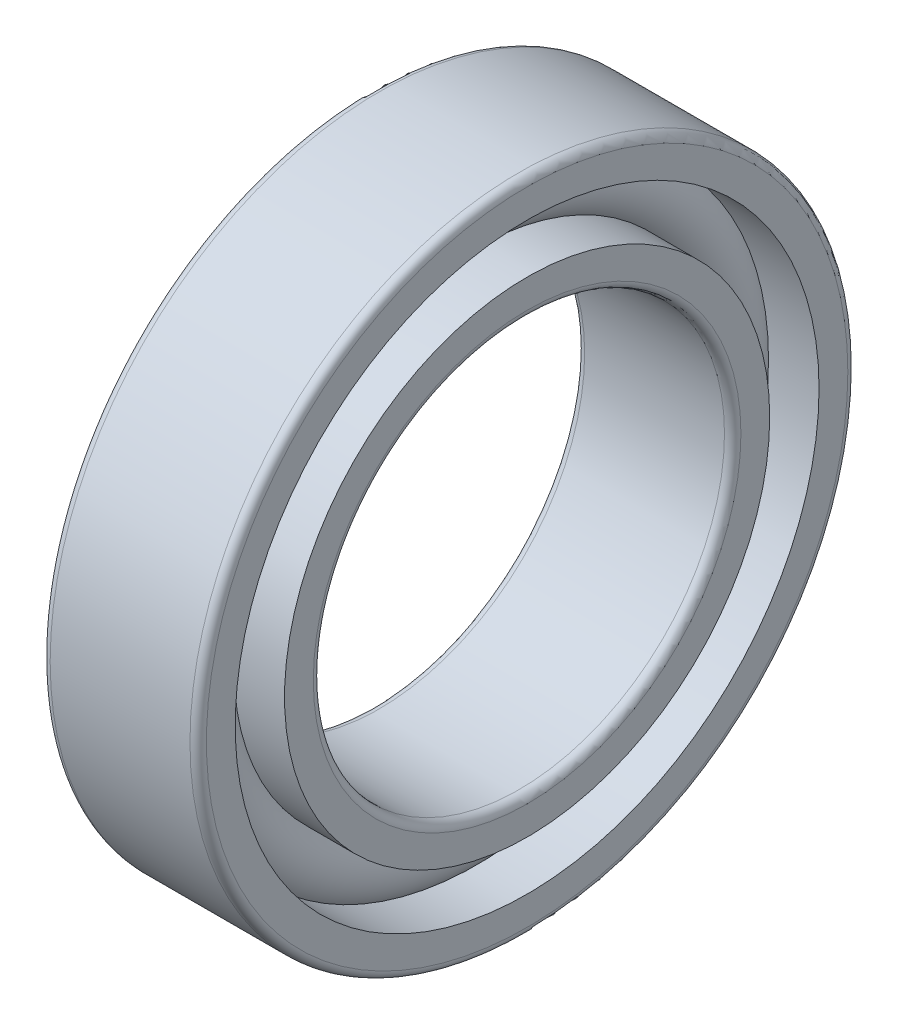
from build123d import *

# Parameters (mm, degrees)
CAGSPISKE_W     = 0.9
CAGSPISKE_H     = 1.5
CAGESPINE_ANGLE = 0.001
BALSIMSKE_R     = 4.5


with BuildPart() as part:
    # CagSpiSke → CageSpine (revolve)
    with BuildSketch(Plane.XY):
        with Locations((0, 32.5)):
            Rectangle(CAGSPISKE_W, CAGSPISKE_H)
    revolve(axis=Axis((-20.6375, 0, 0), (-1, 0, 0)), revolution_arc=CAGESPINE_ANGLE)

    # BalSimSke → BallsSimplified (revolve)
    with BuildSketch(Plane.XY):
        with Locations((0, 32.5)):
            Circle(BALSIMSKE_R)
    revolve(axis=Axis((-10, 0, 0), (1, 0, 0)))

    # InnRacSke → InnerRace (revolve)
    with BuildSketch(Plane.XY):
        with BuildLine():
            Line((-3.320485657, 29.5), (-9.5, 29.5))
            Line((-9.5, 29.5), (-9.5, 26))
            ThreePointArc((-9.5, 26), (-9.207106781, 25.292893219), (-8.5, 25))
            Line((-8.5, 25), (8.5, 25))
            ThreePointArc((8.5, 25), (9.207106781, 25.292893219), (9.5, 26))
            Line((9.5, 26), (9.5, 29.5))
            Line((9.5, 29.5), (3.320485657, 29.5))
            ThreePointArc((3.320485657, 29.5), (0, 28.025), (-3.320485657, 29.5))
        make_face()
    revolve(axis=Axis((-20.6375, 0, 0), (1, 0, 0)))

    # OutRacSke → OuterRace (revolve)
    with BuildSketch(Plane.XY):
        with BuildLine():
            Line((-3.320485657, 35.5), (-9.5, 35.5))
            Line((-9.5, 35.5), (-9.5, 39))
            ThreePointArc((-9.5, 39), (-9.207106781, 39.707106781), (-8.5, 40))
            Line((-8.5, 40), (8.5, 40))
            ThreePointArc((8.5, 40), (9.207106781, 39.707106781), (9.5, 39))
            Line((9.5, 39), (9.5, 35.5))
            Line((9.5, 35.5), (3.320485657, 35.5))
            ThreePointArc((3.320485657, 35.5), (0, 36.975), (-3.320485657, 35.5))
        make_face()
    revolve(axis=Axis((-20.6375, 0, 0), (1, 0, 0)))


solid = part.part
